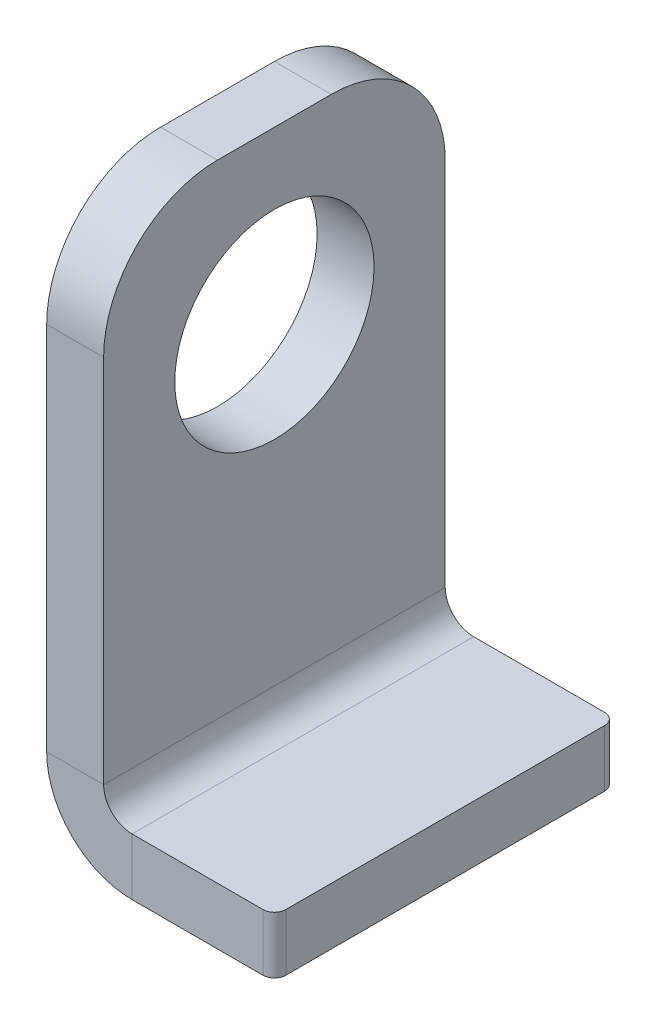
from build123d import *

# Parameters (mm, degrees)
TABAN_FLAN_2_DEPTH    = 60
RADYUS1_R             = 20
RADYUS2_R             = 2
IZIM10_R              = 17.5
KES_EKSTR_ZYON1_DEPTH = 30


# Sheet-metal steps are written as plain solids
with BuildPart() as part:
    # Çizim1 → Taban-Flanş2 (new body)
    with BuildSketch(Plane.XY):
        with BuildLine():
            Line((0, 0), (0, -85))
            ThreePointArc((0, -85), (4.393398282, -95.606601718), (15, -100))
            Line((15, -100), (40, -100))
            Line((40, -100), (40, -90))
            Line((40, -90), (15, -90))
            ThreePointArc((15, -90), (11.464466094, -88.535533906), (10, -85))
            Line((10, -85), (10, 0))
            Line((10, 0), (0, 0))
        make_face()
    extrude(amount=TABAN_FLAN_2_DEPTH)

    # Radyus1
    radyus1_edges = [part.edges().sort_by_distance(p)[0] for p in [
        (5, 0, 0),
        (5, 0, 60),
    ]]
    fillet(radyus1_edges, radius=RADYUS1_R)

    # Radyus2
    radyus2_edges = [part.edges().sort_by_distance(p)[0] for p in [
        (40, -95, 0),
        (40, -95, 60),
    ]]
    fillet(radyus2_edges, radius=RADYUS2_R)

    # Çizim10 → Kes-Ekstrüzyon1 (cut)
    with BuildSketch(Plane.ZY):
        with Locations(Location((30, -30, 0), (0, 0, 270))):
            Circle(IZIM10_R)
    extrude(amount=-KES_EKSTR_ZYON1_DEPTH, mode=Mode.SUBTRACT)


solid = part.part
